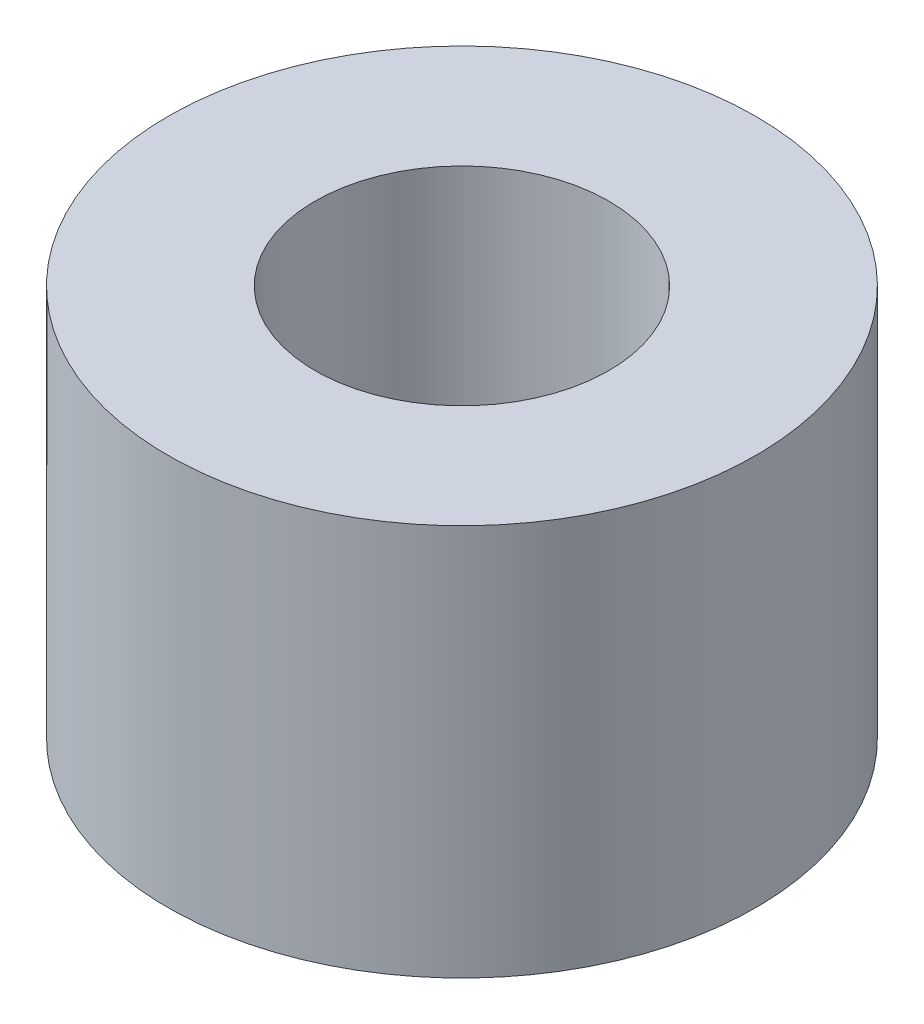
from build123d import *

# Parameters (mm, degrees)
SKETCH4_R           = 28.575
SKETCH4_R_2         = 14.2875
BOSS_EXTRUDE1_DEPTH = 19.05


with BuildPart() as part:
    # Sketch4 → Boss-Extrude1 (new, symmetric)
    with BuildSketch(Plane(origin=(0, 0, 0), x_dir=(1, 0, 0), z_dir=(0, 1, 0))):
        Circle(SKETCH4_R)
        Circle(SKETCH4_R_2, mode=Mode.SUBTRACT)
    extrude(amount=BOSS_EXTRUDE1_DEPTH, both=True)


solid = part.part
